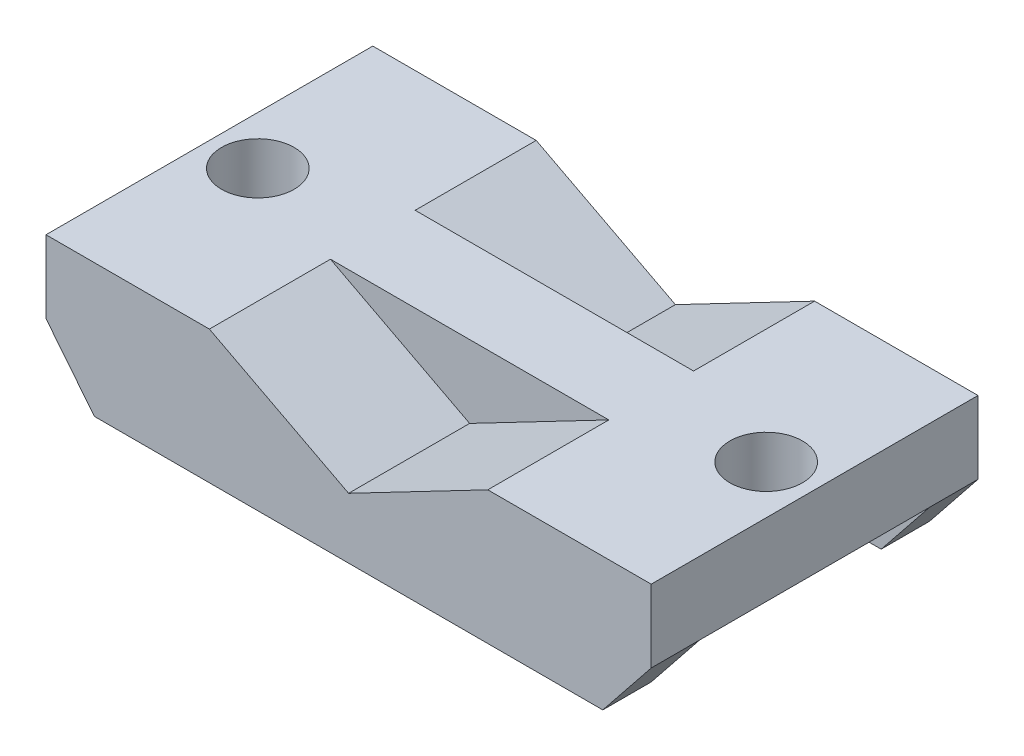
from build123d import *

# Parameters (mm, degrees)
EXTRUDE_1_DEPTH       = 27
EXTRUDE_2_DEPTH       = 7
CUT_EXTRUDE_START     = -19
CUT_EXTRUDE_3_DEPTH   = 38
SKETCH_2_R            = 6
CUT_EXTRUDE_3_2_DEPTH = 61.934390946


# Read off the part's stored shape, not the designer's step: 切除-拉伸-薄壁3
with BuildPart() as part:
    # 草图1 → 凸台-拉伸1 (new, symmetric)
    with BuildSketch(Plane.XY):
        Polygon((23, 12), (0, 0), (-23, 12), (-50, 12), (-50, 0), (-32, 0), (-32, -10), (32, -10), (32, 0), (50, 0), (50, 12), align=None)
        Polygon((-32, 0), (-50, 0), (-42, -10), (-32, -10), align=None)
        Polygon((42, -10), (50, 0), (32, 0), (32, -10), align=None)
    extrude(amount=EXTRUDE_1_DEPTH, both=True)

    # 草图1<4> → 凸台-拉伸2 (add, symmetric)
    with BuildSketch(Plane.XY):
        Polygon((0, 12), (0, 0), (23, 12), align=None)
        Polygon((-23, 12), (0, 0), (0, 12), align=None)
    extrude(amount=EXTRUDE_2_DEPTH, both=True)

    # Cut-Extrude 3 outline → Cut-Extrude 3 (cut)
    with BuildSketch(Plane.XY.offset(CUT_EXTRUDE_START)):
        Polygon((-32, 0), (-50, 0), (-42, -10), (-32, -10), align=None)
    cut_extrude_3 = extrude(amount=CUT_EXTRUDE_3_DEPTH, mode=Mode.SUBTRACT)

    # 镜向1: Cut-Extrude 3 across plane
    add(cut_extrude_3.mirror(Plane(origin=(0, 0, 0), x_dir=(0, 0, 1), z_dir=(1, 0, 0))), mode=Mode.SUBTRACT)

    # 草图2 → Cut-Extrude 3 2 (cut, through all)
    with BuildSketch(Plane(origin=(0, 12, 0), x_dir=(1, 0, 0), z_dir=(0, 1, 0))):
        with Locations(Location((42, 0, 0), (0, 0, 180))):
            Circle(SKETCH_2_R)
        with Locations(Location((-42, 0, 0), (0, 0, 90))):
            Circle(SKETCH_2_R)
    extrude(amount=-CUT_EXTRUDE_3_2_DEPTH, mode=Mode.SUBTRACT)


solid = part.part
